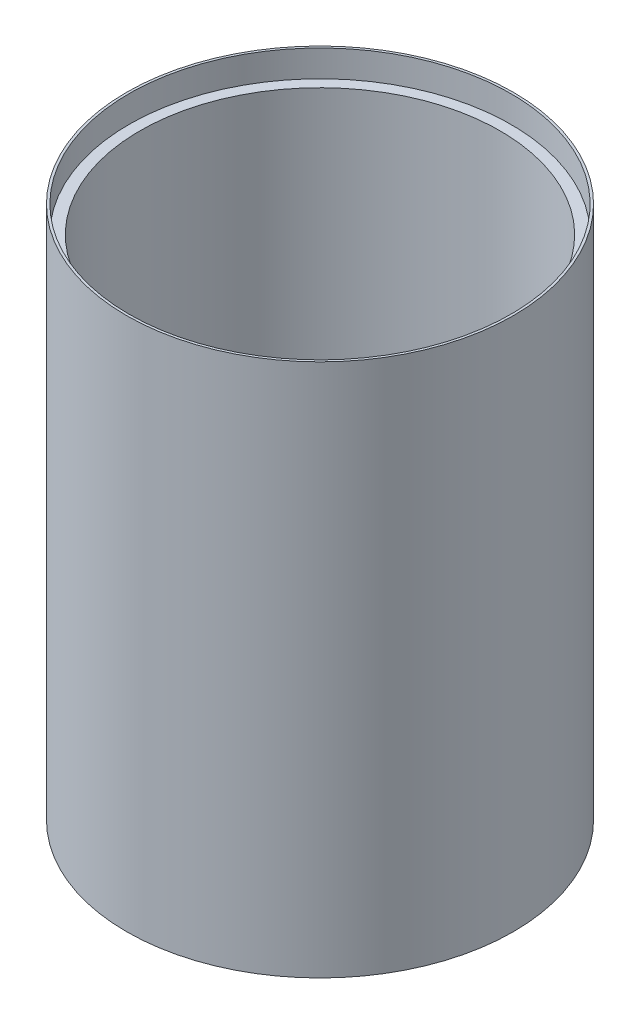
from build123d import *

# Parameters (mm, degrees)
SKETCH_6_R      = 72.5
SKETCH_6_R_2    = 71.6
EXTRUDE_1_DEPTH = 200
SKETCH_6_15_R   = 71.6
SKETCH_6_15_R_2 = 67.5
EXTRUDE_2_DEPTH = 190
SKETCH_6_16_R   = 67.5
EXTRUDE_3_DEPTH = 3


with BuildPart() as part:
    # 草圖6 → 填料-伸長1 (new body)
    with BuildSketch(Plane(origin=(0, 0, 0), x_dir=(1, 0, 0), z_dir=(0, 1, 0))):
        Circle(SKETCH_6_R)
        Circle(SKETCH_6_R_2, mode=Mode.SUBTRACT)
    extrude(amount=EXTRUDE_1_DEPTH)

    # 草圖6<15> → 填料-伸長2 (add)
    with BuildSketch(Plane(origin=(0, 0, 0), x_dir=(1, 0, 0), z_dir=(0, 1, 0))):
        Circle(SKETCH_6_15_R)
        Circle(SKETCH_6_15_R_2, mode=Mode.SUBTRACT)
    extrude(amount=EXTRUDE_2_DEPTH)

    # 草圖6<16> → 填料-伸長3 (add)
    with BuildSketch(Plane(origin=(0, 0, 0), x_dir=(1, 0, 0), z_dir=(0, 1, 0))):
        Circle(SKETCH_6_16_R)
    extrude(amount=EXTRUDE_3_DEPTH)


solid = part.part
